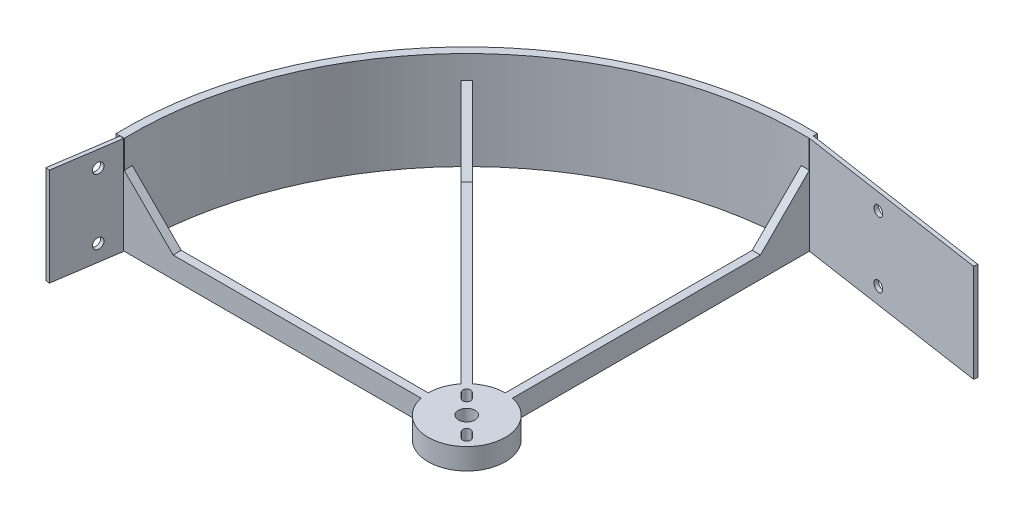
from build123d import *

# Parameters (mm, degrees)
SKETCH1_R            = 15
BOSS_EXTRUDE2_DEPTH  = 8.255
BOSS_EXTRUDE3_DEPTH  = 8.255
BOSS_EXTRUDE4_DEPTH  = 38.1
SKETCH5_R            = 3.249999977
CUT_EXTRUDE3_DEPTH   = 63.5
BOSS_EXTRUDE9_DEPTH  = 3.175
BOSS_EXTRUDE11_DEPTH = 3.175
BOSS_EXTRUDE14_DEPTH = 3.175
SKETCH15_W           = 38.1
SKETCH15_H           = 25.4
BOSS_EXTRUDE15_DEPTH = 1.524
SKETCH16_W           = 38.1
SKETCH16_H           = 76.2
BOSS_EXTRUDE16_DEPTH = 1.524
SKETCH17_R           = 1.98501
CUT_EXTRUDE4_DEPTH   = 2.54
SKETCH18_R           = 1.98501
CUT_EXTRUDE5_DEPTH   = 2.54


with BuildPart() as part:
    # Sketch1 → Boss-Extrude2 (new body)
    with BuildSketch(Plane(origin=(0, 0, 0), x_dir=(1, 0, 0), z_dir=(0, 1, 0))):
        Circle(SKETCH1_R)
    extrude(amount=BOSS_EXTRUDE2_DEPTH)

    # Sketch1<6> → Boss-Extrude3 (add)
    with BuildSketch(Plane(origin=(0, 0, 0), x_dir=(1, 0, 0), z_dir=(0, 1, 0))):
        with BuildLine():
            ThreePointArc((3.175, 130.136274728), (1.587618078, 130.165318322), (0, 130.175))
            Line((0, 130.175), (0, 15))
            ThreePointArc((0, 15), (1.596569562, 14.914790164), (3.175, 14.660128751))
            Line((3.175, 14.660128751), (3.175, 130.136274728))
        make_face()
        with BuildLine():
            Line((-9.42450178, 11.66956581), (-90.918248264, 93.163312294))
            ThreePointArc((-90.918248264, 93.163312294), (-92.047625241, 92.047625241), (-93.163312294, 90.918248264))
            Line((-93.163312294, 90.918248264), (-11.66956581, 9.42450178))
            ThreePointArc((-11.66956581, 9.42450178), (-10.606601718, 10.606601718), (-9.42450178, 11.66956581))
        make_face()
        with BuildLine():
            Line((-15, 0), (-130.175, 0))
            ThreePointArc((-130.175, 0), (-130.165318322, -1.587618078), (-130.136274728, -3.175))
            Line((-130.136274728, -3.175), (-14.660128751, -3.175))
            ThreePointArc((-14.660128751, -3.175), (-14.914790164, -1.596569562), (-15, 0))
        make_face()
    extrude(amount=BOSS_EXTRUDE3_DEPTH)

    # Sketch1<7> → Boss-Extrude4 (add)
    with BuildSketch(Plane(origin=(0, 0, 0), x_dir=(1, 0, 0), z_dir=(0, 1, 0))):
        with BuildLine():
            ThreePointArc((-90.918248264, 93.163312294), (-49.08154667, 120.567542902), (0, 130.175))
            ThreePointArc((0, 130.175), (1.587618078, 130.165318322), (3.175, 130.136274728))
            Line((3.175, 130.136274728), (3.175, 133.312197023))
            ThreePointArc((3.175, 133.312197023), (-94.292689271, 94.292689271), (-133.312197023, -3.175))
            Line((-133.312197023, -3.175), (-130.136274728, -3.175))
            ThreePointArc((-130.136274728, -3.175), (-130.165318322, -1.587618078), (-130.175, 0))
            ThreePointArc((-130.175, 0), (-120.567542902, 49.08154667), (-93.163312294, 90.918248264))
            ThreePointArc((-93.163312294, 90.918248264), (-92.047625241, 92.047625241), (-90.918248264, 93.163312294))
        make_face()
    extrude(amount=BOSS_EXTRUDE4_DEPTH)

    # Sketch5 → Cut-Extrude3 (cut)
    with BuildSketch(Plane(origin=(0, 8.255, 0), x_dir=(1, 0, 0), z_dir=(0, 1, 0))):
        Circle(SKETCH5_R)
        with BuildLine():
            Line((-6.64538953, 4.490128061), (-8.800650999, 6.64538953))
            ThreePointArc((-8.800650999, 6.64538953), (-8.800650999, 8.800650999), (-6.64538953, 8.800650999))
            Line((-6.64538953, 8.800650999), (-4.490128061, 6.64538953))
            ThreePointArc((-4.490128061, 6.64538953), (-4.490128061, 4.490128061), (-6.64538953, 4.490128061))
        make_face()
        with BuildLine():
            Line((4.490128061, -6.64538953), (6.64538953, -8.800650999))
            ThreePointArc((6.64538953, -8.800650999), (8.800650999, -8.800650999), (8.800650999, -6.64538953))
            Line((8.800650999, -6.64538953), (6.64538953, -4.490128061))
            ThreePointArc((6.64538953, -4.490128061), (4.490128061, -4.490128061), (4.490128061, -6.64538953))
        make_face()
    extrude(amount=-CUT_EXTRUDE3_DEPTH, mode=Mode.SUBTRACT)

    # Sketch10 → Boss-Extrude9 (add)
    with BuildSketch(Plane(origin=(0, 0, 0), x_dir=(-1, 0, 0), z_dir=(0, 0, -1))):
        Polygon((130.175, 27.305), (130.175, 8.255), (111.125, 8.255), align=None)
    extrude(amount=-BOSS_EXTRUDE9_DEPTH)

    # Sketch13 → Boss-Extrude11 (add)
    with BuildSketch(Plane.ZY):
        Polygon((-130.175, 27.305), (-111.125, 8.255), (-130.175, 8.255), align=None)
    extrude(amount=-BOSS_EXTRUDE11_DEPTH)

    # Sketch14 → Boss-Extrude14 (add)
    with BuildSketch(Plane(origin=(1.122532015, 0, -1.122532015), x_dir=(-0.7071067811865591, 0, -0.707106781186536), z_dir=(0.707106781186536, 0, -0.7071067811865591))):
        Polygon((133.340319762, 8.255), (111.115319762, 8.255), (133.340319762, 32.394680238), align=None)
    extrude(amount=-BOSS_EXTRUDE14_DEPTH)

    # Sketch16 → Boss-Extrude16 (add)
    with BuildSketch(Plane(origin=(19.325585898, 0, -129.31051464), x_dir=(0, -1, 0), z_dir=(0.14780941112960744, 0, -0.9890158633619173))):
        with Locations((-19.05, -21.77004363)):
            Rectangle(SKETCH16_W, SKETCH16_H)
    extrude(amount=-BOSS_EXTRUDE16_DEPTH)

    # Sketch17 → Cut-Extrude4 (cut)
    with BuildSketch(Plane(origin=(19.325585898, 0, -129.31051464), x_dir=(-0.9890158633619174, 0, -0.1478094111296074), z_dir=(0.1478094111296074, 0, -0.9890158633619174))):
        with Locations((-15.810168028, 31.75)):
            Circle(SKETCH17_R)
        with Locations((-15.810168028, 6.35)):
            Circle(SKETCH17_R)
    extrude(amount=-CUT_EXTRUDE4_DEPTH, mode=Mode.SUBTRACT)


with BuildPart() as body_2:
    # Sketch15 → Boss-Extrude15 (new body)
    with BuildSketch(Plane(origin=(-128.382234478, 0, -19.186853498), x_dir=(0, -1, 0), z_dir=(-0.9890158633619163, 0, -0.14780941112961427))):
        with Locations((-19.05, 35.310207102)):
            Rectangle(SKETCH15_W, SKETCH15_H)
    extrude(amount=-BOSS_EXTRUDE15_DEPTH)

    # Sketch18 → Cut-Extrude5 (cut)
    with BuildSketch(Plane(origin=(-128.382234478, 0, -19.186853498), x_dir=(-0.1478094111296151, 0, 0.9890158633619162), z_dir=(-0.9890158633619162, 0, -0.1478094111296151))):
        with Locations((31.2654915, 31.75)):
            Circle(SKETCH18_R)
        with Locations((31.2654915, 6.35)):
            Circle(SKETCH18_R)
    extrude(amount=-CUT_EXTRUDE5_DEPTH, mode=Mode.SUBTRACT)


solid = Compound([part.part, body_2.part])
